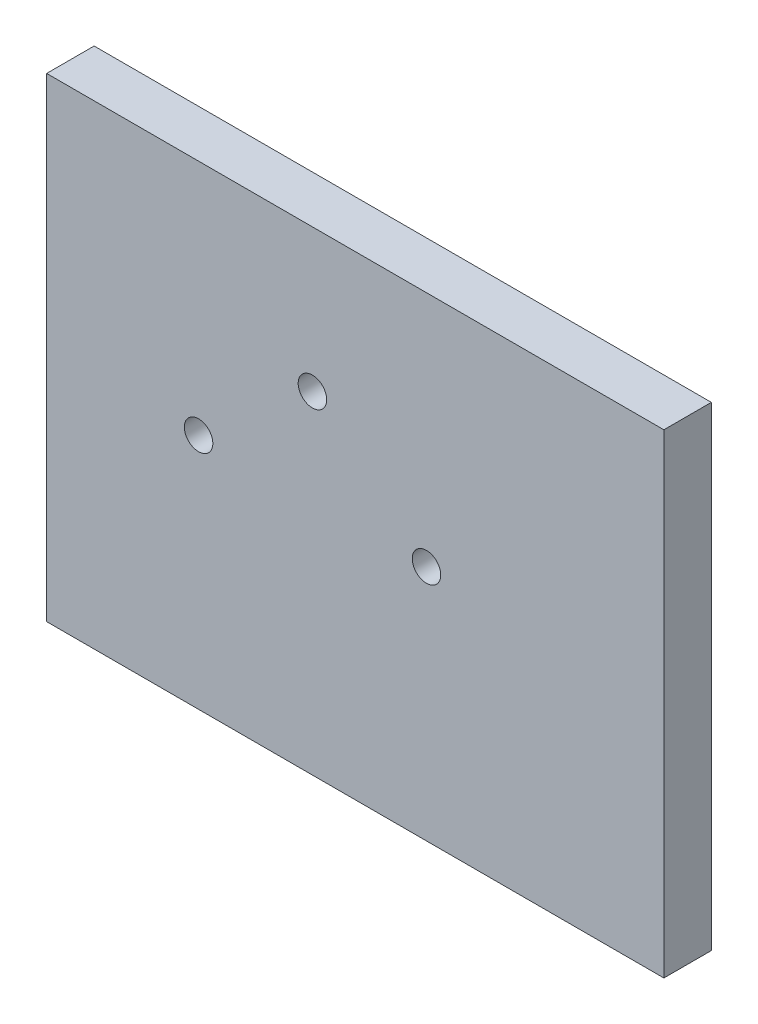
from build123d import *

# Parameters (mm, degrees)
SKETCH3_W           = 65
SKETCH3_H           = 50
BOSS_EXTRUDE2_DEPTH = 5
SKETCH4_R           = 1.5
CUT_EXTRUDE2_DEPTH  = 5


with BuildPart() as part:
    # Sketch3 → Boss-Extrude2 (new body)
    with BuildSketch(Plane.XY):
        with Locations((32.5, -25)):
            Rectangle(SKETCH3_W, SKETCH3_H)
    extrude(amount=BOSS_EXTRUDE2_DEPTH)

    # Sketch4 → Cut-Extrude2 (cut)
    with BuildSketch(Plane.XY.offset(5)):
        with Locations((40, -25)):
            Circle(SKETCH4_R)
        with Locations((16, -25)):
            Circle(SKETCH4_R)
        with Locations((27.986991667, -15.016411928)):
            Circle(SKETCH4_R)
    extrude(amount=-CUT_EXTRUDE2_DEPTH, mode=Mode.SUBTRACT)


solid = part.part
